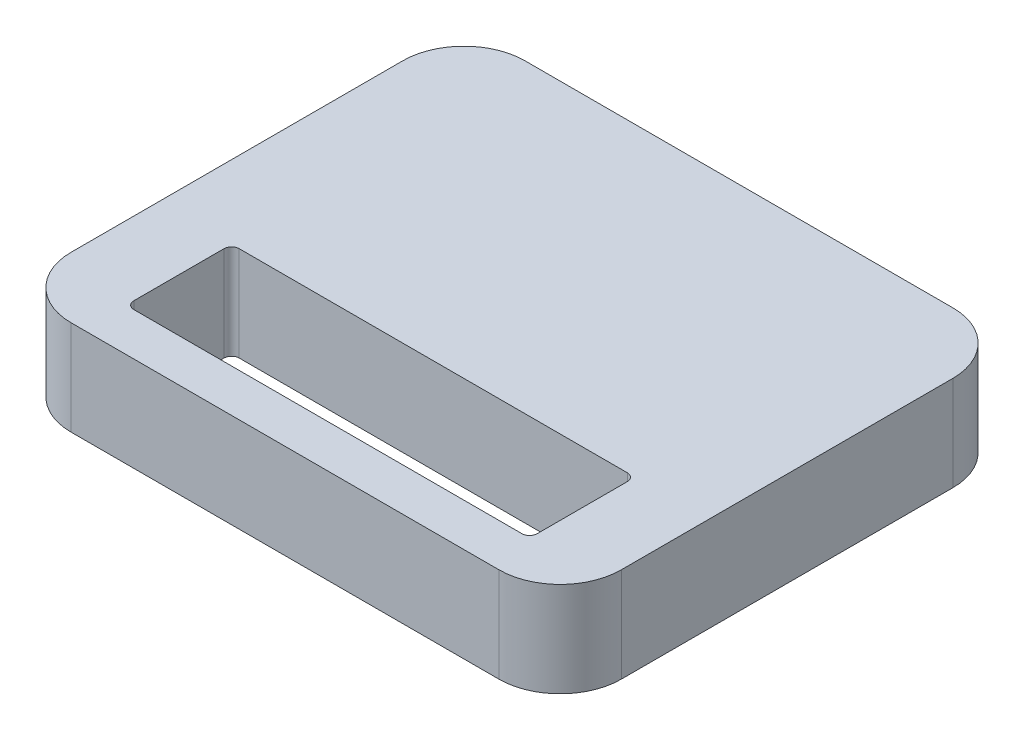
from build123d import *

# Parameters (mm, degrees)
SKETCH1_W           = 36
SKETCH1_H           = 29.7
SKETCH1_W_2         = 26.4
SKETCH1_H_2         = 6.9
BOSS_EXTRUDE1_DEPTH = 6.2
FILLET1_R           = 4
FILLET2_R           = 0.5


with BuildPart() as part:
    # Sketch1 → Boss-Extrude1 (new body)
    with BuildSketch(Plane(origin=(0, 0, 0), x_dir=(1, 0, 0), z_dir=(0, 1, 0))):
        with Locations((0, 8.6)):
            Rectangle(SKETCH1_W, SKETCH1_H)
        Rectangle(SKETCH1_W_2, SKETCH1_H_2, mode=Mode.SUBTRACT)
    extrude(amount=BOSS_EXTRUDE1_DEPTH)

    # Fillet1
    fillet1_edges = [part.edges().sort_by_distance(p)[0] for p in [
        (18, 3.1, -23.45),
        (18, 3.1, 6.25),
        (-18, 3.1, 6.25),
        (-18, 3.1, -23.45),
    ]]
    fillet(fillet1_edges, radius=FILLET1_R)

    # Fillet2
    fillet2_edges = [part.edges().sort_by_distance(p)[0] for p in [
        (-13.2, 3.1, 3.45),
        (13.2, 3.1, 3.45),
        (13.2, 3.1, -3.45),
        (-13.2, 3.1, -3.45),
    ]]
    fillet(fillet2_edges, radius=FILLET2_R)


solid = part.part
